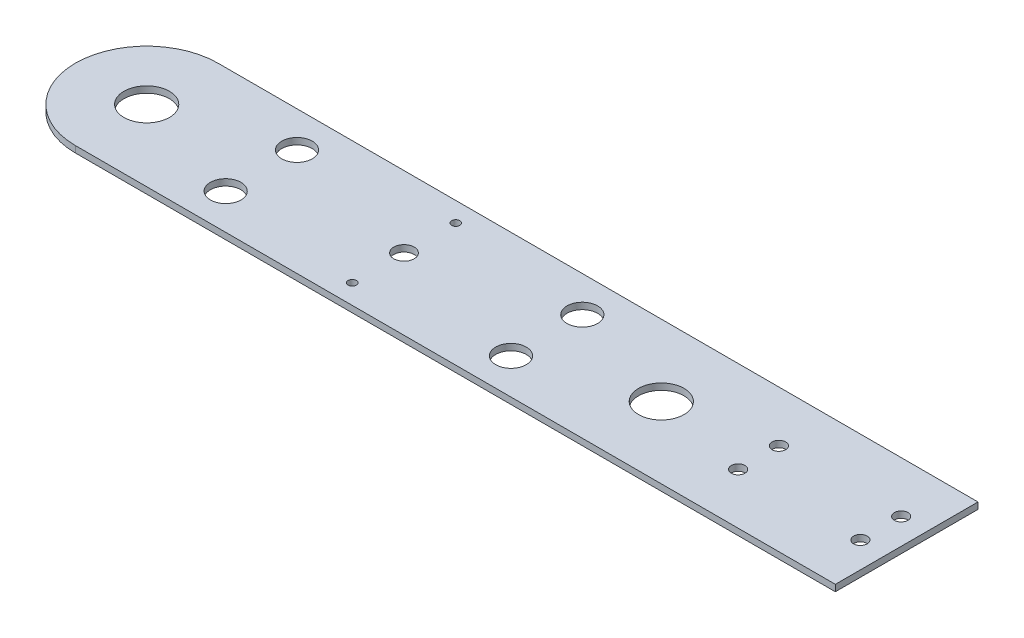
from build123d import *

# Parameters (mm, degrees)
SKETCH1_R           = 11.15
SKETCH1_R_2         = 7.5
SKETCH1_R_3         = 2.02
SKETCH1_R_4         = 3.325
BOSS_EXTRUDE1_DEPTH = 3.175


with BuildPart() as part:
    # Sketch1 → Boss-Extrude1 (new body)
    with BuildSketch(Plane(origin=(0, 0, 0), x_dir=(1, 0, 0), z_dir=(0, 1, 0))):
        with BuildLine():
            ThreePointArc((-126.258214395, 35), (-161.258214395, 0), (-126.258214395, -35))
            Line((-126.258214395, -35), (246.658214395, -35))
            Line((246.658214395, -35), (246.658214395, 35))
            Line((246.658214395, 35), (-126.258214395, 35))
        make_face()
        with Locations((-126.258214395, 0)):
            Circle(SKETCH1_R, mode=Mode.SUBTRACT)
        with Locations((-70, -17.5)):
            Circle(SKETCH1_R_2, mode=Mode.SUBTRACT)
        with Locations((0, -25.4)):
            Circle(SKETCH1_R_3, mode=Mode.SUBTRACT)
        with BuildLine():
            ThreePointArc((5, 0), (0, -5), (-5, 0))
            ThreePointArc((-5, 0), (0, 5), (5, 0))
        make_face(mode=Mode.SUBTRACT)
        with Locations((70, -17.5)):
            Circle(SKETCH1_R_2, mode=Mode.SUBTRACT)
        with Locations((173.958214395, -10)):
            Circle(SKETCH1_R_4, mode=Mode.SUBTRACT)
        with Locations((233.958214395, -10)):
            Circle(SKETCH1_R_4, mode=Mode.SUBTRACT)
        with Locations((-70, 17.5)):
            Circle(SKETCH1_R_2, mode=Mode.SUBTRACT)
        with Locations((0, 25.4)):
            Circle(SKETCH1_R_3, mode=Mode.SUBTRACT)
        with Locations((126.258214395, 0)):
            Circle(SKETCH1_R, mode=Mode.SUBTRACT)
        with Locations((70, 17.5)):
            Circle(SKETCH1_R_2, mode=Mode.SUBTRACT)
        with Locations((173.958214395, 10)):
            Circle(SKETCH1_R_4, mode=Mode.SUBTRACT)
        with Locations((233.958214395, 10)):
            Circle(SKETCH1_R_4, mode=Mode.SUBTRACT)
    extrude(amount=BOSS_EXTRUDE1_DEPTH)


solid = part.part
